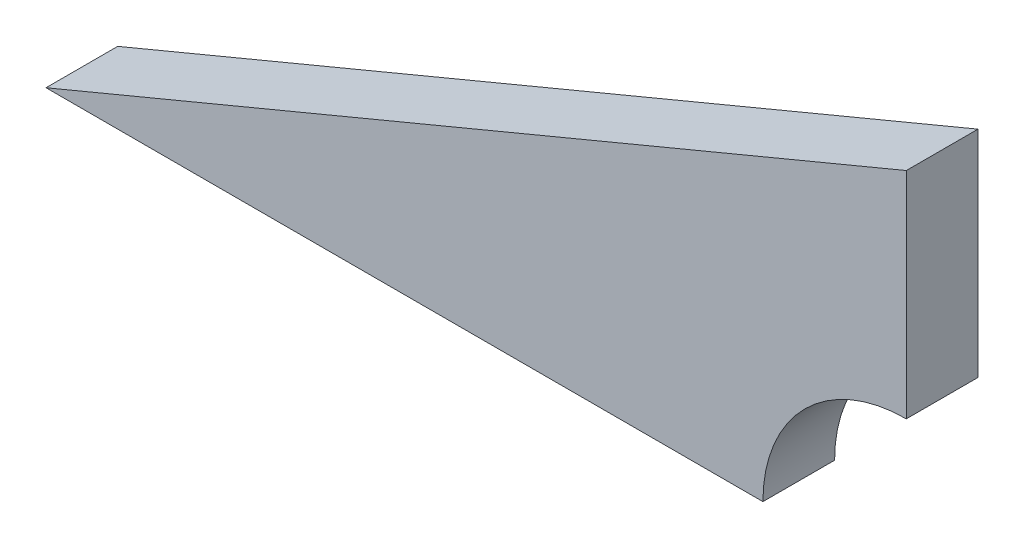
from build123d import *

# Parameters (mm, degrees)
AUFSATZ_LINEAR_AUSTRAGEN1_DEPTH = 5


with BuildPart() as part:
    # Skizze1 → Aufsatz-Linear austragen1 (new, symmetric)
    with BuildSketch(Plane.XY):
        with BuildLine():
            Line((0, 20), (0, 50))
            Line((0, 50), (-120, 0))
            Line((-120, 0), (-20, 0))
            ThreePointArc((-20, 0), (-14.142135624, 14.142135624), (0, 20))
        make_face()
    extrude(amount=AUFSATZ_LINEAR_AUSTRAGEN1_DEPTH, both=True)


solid = part.part
